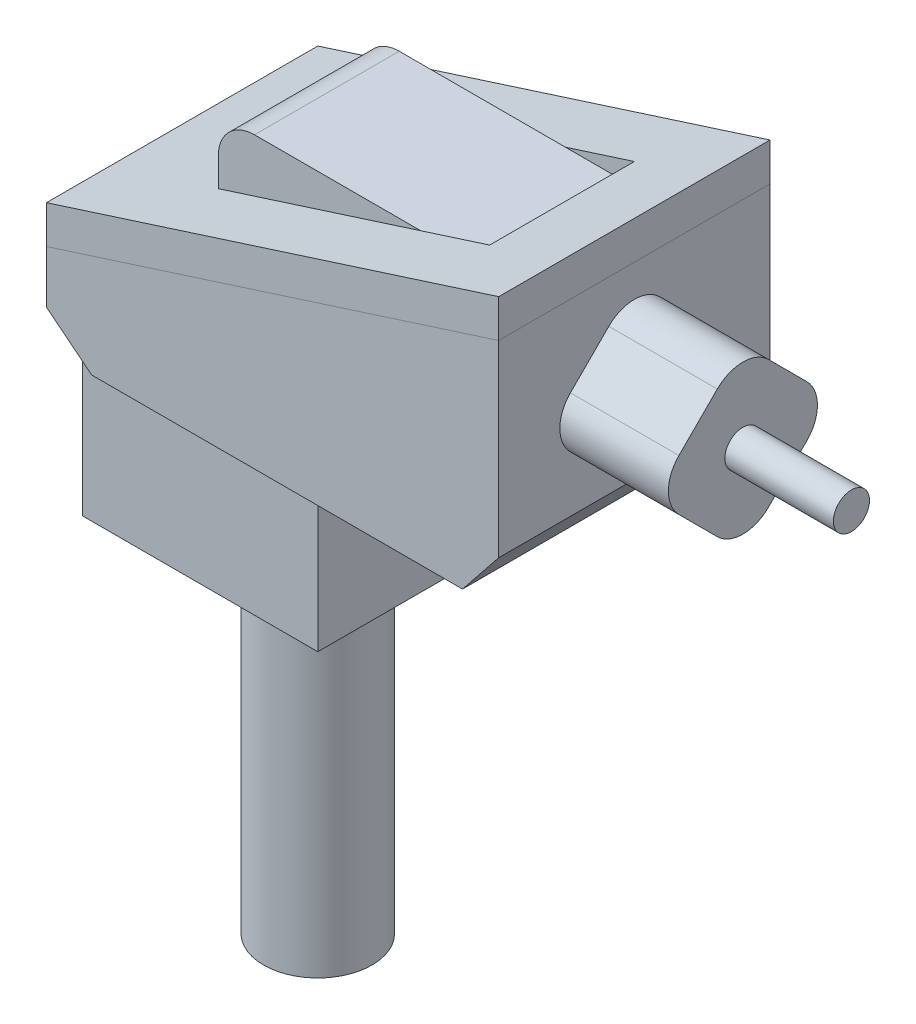
from build123d import *

# Parameters (mm, degrees)
ESQUISSE1_R                  = 3
BOSS_EXTRU_1_DEPTH           = 20
ESQUISSE2_W                  = 13
ESQUISSE2_H                  = 13
BOSS_EXTRU_2_DEPTH           = 8
BOSS_EXTRU_3_DEPTH           = 7.5
ESQUISSE4_W                  = 11.1875
ESQUISSE4_H                  = 3.58
BOSS_EXTRU_4_DEPTH           = 4
ESQUISSE5_W                  = 15
ESQUISSE5_H                  = 8
ENL_V_MAT_EXTRU_1_DEPTH      = 45.752094923
BOSS_EXTRU_5_DEPTH           = 6
ESQUISSE7_R                  = 1
BOSS_EXTRU_6_DEPTH           = 6
CONG_1_R                     = 2
FRACTIONNER1_SURFACE_1_BACK  = 59.677
FRACTIONNER1_SURFACE_1_DEPTH = 119.354
FRACTIONNER1_SURFACE_2_BACK  = 59.677
FRACTIONNER1_SURFACE_2_DEPTH = 119.354


with BuildPart() as part:
    # Esquisse1 → Boss.-Extru.1 (new body)
    with BuildSketch(Plane(origin=(0, 0, 0), x_dir=(1, 0, 0), z_dir=(0, 1, 0))):
        with Locations(Location((0, 0, 0), (0, 0, 270))):
            Circle(ESQUISSE1_R)
    extrude(amount=-BOSS_EXTRU_1_DEPTH)

    # Esquisse2 → Boss.-Extru.2 (add)
    with BuildSketch(Plane(origin=(0, 0, 0), x_dir=(1, 0, 0), z_dir=(0, 1, 0))):
        Rectangle(ESQUISSE2_W, ESQUISSE2_H)
    extrude(amount=BOSS_EXTRU_2_DEPTH)

    # Esquisse3 → Boss.-Extru.3 (add, symmetric)
    with BuildSketch(Plane.XY):
        Polygon((-7.5, 15), (-7.5, 10), (-5, 8), (15.5, 8), (17.5, 10.5), (17.5, 23), align=None)
    extrude(amount=BOSS_EXTRU_3_DEPTH, both=True)

    # Esquisse4 → Boss.-Extru.4 (add, symmetric)
    with BuildSketch(Plane.XY):
        with Locations((4.09375, 18.71)):
            Rectangle(ESQUISSE4_W, ESQUISSE4_H)
    extrude(amount=BOSS_EXTRU_4_DEPTH, both=True)

    # Esquisse5 → Enlèv. mat.-Extru.1 (cut, through all)
    with BuildSketch(Plane(origin=(0, 20.5, 0), x_dir=(1, 0, 0), z_dir=(0, 1, 0))):
        with Locations((6, 0)):
            Rectangle(ESQUISSE5_W, ESQUISSE5_H)
    extrude(amount=ENL_V_MAT_EXTRU_1_DEPTH, mode=Mode.SUBTRACT)

    # Esquisse6 → Boss.-Extru.5 (add)
    with BuildSketch(Plane(origin=(17.5, 0, 0), x_dir=(0, 0, -1), z_dir=(1, 0, 0))):
        Polygon((-4.949747468, 15), (0, 10.050252532), (4.949747468, 15), (0, 19.949747468), align=None)
    extrude(amount=BOSS_EXTRU_5_DEPTH)

    # Esquisse7 → Boss.-Extru.6 (add)
    with BuildSketch(Plane(origin=(23.5, 0, 0), x_dir=(0, 0, -1), z_dir=(1, 0, 0))):
        with Locations(Location((0, 15, 0), (0, 0, 180))):
            Circle(ESQUISSE7_R)
    extrude(amount=BOSS_EXTRU_6_DEPTH)

    # Congé1
    # the kernel refuses this fillet: 2 mm, written as the material it takes off along each edge
    with BuildSketch(Plane(origin=(-1.5, 20.5, -9), x_dir=(0, -1, 0), z_dir=(0, 0, 1))) as cong_1_piece_1:
        with BuildLine():
            CenterArc((CONG_1_R, CONG_1_R), CONG_1_R, 180, 90)
            Line((0, CONG_1_R), (0, 0))
            Line((0, 0), (CONG_1_R, 0))
        make_face()
    extrude(amount=18, mode=Mode.SUBTRACT)
    with BuildSketch(Plane(origin=(17.5, 19.949747468, 0), x_dir=(0, -0.7071067811865478, -0.7071067811865475), z_dir=(1, 0, 0)), Plane(origin=(17.5, 15, 4.949747468), x_dir=(0, 0.707106781186548, -0.7071067811865471), z_dir=(1, 0, 0)), Plane(origin=(17.5, 15, -4.949747468), x_dir=(0, -0.7071067811865478, 0.7071067811865474), z_dir=(1, 0, 0))) as cong_1_piece_2:
        with BuildLine():
            CenterArc((CONG_1_R, -CONG_1_R), CONG_1_R, 90, 90)
            Line((0, -CONG_1_R), (0, 0))
            Line((0, 0), (CONG_1_R, 0))
        make_face()
    extrude(amount=11, mode=Mode.SUBTRACT)
    with BuildSketch(Plane(origin=(17.5, 10.050252532, 0), x_dir=(0, 0.7071067811865479, -0.7071067811865474), z_dir=(1, 0, 0))) as cong_1_piece_3:
        with BuildLine():
            CenterArc((CONG_1_R, CONG_1_R), CONG_1_R, 180, 90)
            Line((0, CONG_1_R), (0, 0))
            Line((0, 0), (CONG_1_R, 0))
        make_face()
    extrude(amount=11, mode=Mode.SUBTRACT)


with BuildPart() as body_2:
    # Fractionner1: the piece behind the surface
    add(part.part)
    # Fractionner1 surface: a surface, the sketch's curves swept straight by 119.354 mm
    with BuildLine(Plane.XY.offset(7.5).offset(-FRACTIONNER1_SURFACE_1_BACK), mode=Mode.PRIVATE) as fractionner1_surface_1_path:
        Line((-7.5, 12.90009524), (17.5, 20.90009524))
    fractionner1_surface_1 = Shell.extrude(fractionner1_surface_1_path.wire(), (0 * FRACTIONNER1_SURFACE_1_DEPTH, 0 * FRACTIONNER1_SURFACE_1_DEPTH, 1 * FRACTIONNER1_SURFACE_1_DEPTH))
    split(bisect_by=fractionner1_surface_1, keep=Keep.BOTTOM)


with BuildPart() as part_1:
    add(part.part)

    # Fractionner1: split by a surface, the side it looks to stays
    # Fractionner1 surface: a surface, the sketch's curves swept straight by 119.354 mm
    with BuildLine(Plane.XY.offset(7.5).offset(-FRACTIONNER1_SURFACE_2_BACK), mode=Mode.PRIVATE) as fractionner1_surface_2_path:
        Line((-7.5, 12.90009524), (17.5, 20.90009524))
    fractionner1_surface_2 = Shell.extrude(fractionner1_surface_2_path.wire(), (0 * FRACTIONNER1_SURFACE_2_DEPTH, 0 * FRACTIONNER1_SURFACE_2_DEPTH, 1 * FRACTIONNER1_SURFACE_2_DEPTH))
    split(bisect_by=fractionner1_surface_2, keep=Keep.TOP)


solid = Compound([body_2.part, part_1.part])
